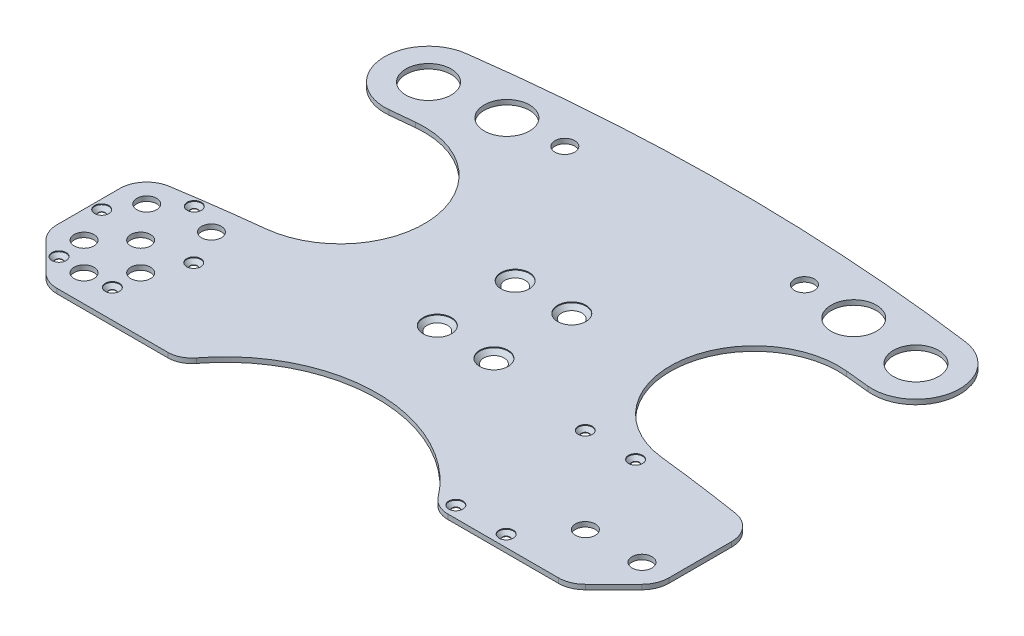
from build123d import *

# Parameters (mm, degrees)
SKETCH1_R                                      = 2.5
BOSS_EXTRUDE1_DEPTH                            = 1.7
CUT_EXTRUDE1_REACH                             = 155.062
SKETCH2_R                                      = 3.5
SKETCH2_R_2                                    = 8
CUT_EXTRUDE2_REACH                             = 155.062
SKETCH3_R                                      = 1.3
FILLET1_R                                      = 8.5
CUT_EXTRUDE3_REACH                             = 136.744
SKETCH8_R                                      = 1.25
CSK_FOR_M5_FLAT_HEAD_MACHINE_SCREW1_AT_2_COUNT = 2
CSK_FOR_M5_FLAT_HEAD_MACHINE_SCREW1_AT_2_PITCH = 20
CSK_FOR_M5_FLAT_HEAD_MACHINE_SCREW1_AT_3_COUNT = 2
CSK_FOR_M5_FLAT_HEAD_MACHINE_SCREW1_AT_3_PITCH = 34.003676272
CSK_FOR_M5_FLAT_HEAD_MACHINE_SCREW1_AT_4_COUNT = 2
CSK_FOR_M5_FLAT_HEAD_MACHINE_SCREW1_AT_4_PITCH = 27.5
CSK_FOR_M2_5_FLAT_HEAD_MACHINE_SCREW1_AT_COUNT = 2
CSK_FOR_M2_5_FLAT_HEAD_MACHINE_SCREW1_AT_PITCH = 17.78
CSK_FOR_M2_5_FLAT_HEAD_MACHINE_SCREW_2_COUNT   = 2
CSK_FOR_M2_5_FLAT_HEAD_MACHINE_SCREW_2_PITCH   = 49.055548106
CSK_FOR_M2_5_FLAT_HEAD_MACHINE_SCREW_3_COUNT   = 2
CSK_FOR_M2_5_FLAT_HEAD_MACHINE_SCREW_3_PITCH   = 45.72
CSK_FOR_M2_5_FLAT_HEAD_MACHINE_SCREW_4_COUNT   = 2
CSK_FOR_M2_5_FLAT_HEAD_MACHINE_SCREW_4_PITCH   = 137.589286773
CSK_FOR_M2_5_FLAT_HEAD_MACHINE_SCREW_5_COUNT   = 2
CSK_FOR_M2_5_FLAT_HEAD_MACHINE_SCREW_5_PITCH   = 121.758213801
CSK_FOR_M2_5_FLAT_HEAD_MACHINE_SCREW_6_COUNT   = 2
CSK_FOR_M2_5_FLAT_HEAD_MACHINE_SCREW_6_PITCH   = 153.980488141
CSK_FOR_M2_5_FLAT_HEAD_MACHINE_SCREW_7_COUNT   = 2
CSK_FOR_M2_5_FLAT_HEAD_MACHINE_SCREW_7_PITCH   = 151.428910743
CSK_FOR_M2_5_FLAT_HEAD_MACHINE_SCREW_8_COUNT   = 2
CSK_FOR_M2_5_FLAT_HEAD_MACHINE_SCREW_8_PITCH   = 133.343575359


with BuildPart() as part:
    # Sketch1 → Boss-Extrude1 (new body)
    with BuildSketch(Plane(origin=(0, 0, 0), x_dir=(1, 0, 0), z_dir=(0, 1, 0))):
        with BuildLine():
            Line((-73.314391493, -95), (73.314391493, -95))
            ThreePointArc((73.314391493, -95), (120, 0), (73.314391493, 95))
            Line((73.314391493, 95), (-73.314391493, 95))
            ThreePointArc((-73.314391493, 95), (-120, 0), (-73.314391493, -95))
        make_face()
        with Locations((-10, 13.75)):
            Circle(SKETCH1_R, mode=Mode.SUBTRACT)
        with Locations((-10, -13.75)):
            Circle(SKETCH1_R, mode=Mode.SUBTRACT)
        with Locations((10, -13.75)):
            Circle(SKETCH1_R, mode=Mode.SUBTRACT)
        with Locations((10, 13.75)):
            Circle(SKETCH1_R, mode=Mode.SUBTRACT)
    extrude(amount=BOSS_EXTRUDE1_DEPTH)

    # Sketch2 → Cut-Extrude1 (cut, up to next)
    with BuildSketch(Plane(origin=(0, 1.7, 0), x_dir=(1, 0, 0), z_dir=(0, 1, 0)), mode=Mode.PRIVATE) as cut_extrude1_sk1:
        with Locations((-88.540600769, -40)):
            Circle(SKETCH2_R)
    cut_extrude1_tool1 = extrude(cut_extrude1_sk1.sketch, amount=-CUT_EXTRUDE1_REACH, mode=Mode.PRIVATE) & part.part
    # Sketch2 → Cut-Extrude1 (cut, up to next)
    with BuildSketch(Plane(origin=(0, 1.7, 0), x_dir=(1, 0, 0), z_dir=(0, 1, 0)), mode=Mode.PRIVATE) as cut_extrude1_sk2:
        with Locations((-78.540600769, -50)):
            Circle(SKETCH2_R)
    cut_extrude1_tool2 = extrude(cut_extrude1_sk2.sketch, amount=-CUT_EXTRUDE1_REACH, mode=Mode.PRIVATE) & part.part
    # Sketch2 → Cut-Extrude1 (cut, up to next)
    with BuildSketch(Plane(origin=(0, 1.7, 0), x_dir=(1, 0, 0), z_dir=(0, 1, 0)), mode=Mode.PRIVATE) as cut_extrude1_sk3:
        with Locations((-88.540600769, -60)):
            Circle(SKETCH2_R)
    cut_extrude1_tool3 = extrude(cut_extrude1_sk3.sketch, amount=-CUT_EXTRUDE1_REACH, mode=Mode.PRIVATE) & part.part
    # Sketch2 → Cut-Extrude1 (cut, up to next)
    with BuildSketch(Plane(origin=(0, 1.7, 0), x_dir=(1, 0, 0), z_dir=(0, 1, 0)), mode=Mode.PRIVATE) as cut_extrude1_sk4:
        with Locations((-98.540600769, -50)):
            Circle(SKETCH2_R)
    cut_extrude1_tool4 = extrude(cut_extrude1_sk4.sketch, amount=-CUT_EXTRUDE1_REACH, mode=Mode.PRIVATE) & part.part
    # Sketch2 → Cut-Extrude1 (cut, up to next)
    with BuildSketch(Plane(origin=(0, 1.7, 0), x_dir=(1, 0, 0), z_dir=(0, 1, 0)), mode=Mode.PRIVATE) as cut_extrude1_sk5:
        with Locations((78.540600769, -50)):
            Circle(SKETCH2_R)
    cut_extrude1_tool5 = extrude(cut_extrude1_sk5.sketch, amount=-CUT_EXTRUDE1_REACH, mode=Mode.PRIVATE) & part.part
    # Sketch2 → Cut-Extrude1 (cut, up to next)
    with BuildSketch(Plane(origin=(0, 1.7, 0), x_dir=(1, 0, 0), z_dir=(0, 1, 0)), mode=Mode.PRIVATE) as cut_extrude1_sk6:
        with Locations((98.540600769, -50)):
            Circle(SKETCH2_R)
    cut_extrude1_tool6 = extrude(cut_extrude1_sk6.sketch, amount=-CUT_EXTRUDE1_REACH, mode=Mode.PRIVATE) & part.part
    # Sketch2 → Cut-Extrude1 (cut, up to next)
    with BuildSketch(Plane(origin=(0, 1.7, 0), x_dir=(1, 0, 0), z_dir=(0, 1, 0)), mode=Mode.PRIVATE) as cut_extrude1_sk7:
        with Locations((-98.540600769, -27.862546721)):
            Circle(SKETCH2_R)
    cut_extrude1_tool7 = extrude(cut_extrude1_sk7.sketch, amount=-CUT_EXTRUDE1_REACH, mode=Mode.PRIVATE) & part.part
    # Sketch2 → Cut-Extrude1 (cut, up to next)
    with BuildSketch(Plane(origin=(0, 1.7, 0), x_dir=(1, 0, 0), z_dir=(0, 1, 0)), mode=Mode.PRIVATE) as cut_extrude1_sk8:
        with Locations((-78.540600769, -25)):
            Circle(SKETCH2_R)
    cut_extrude1_tool8 = extrude(cut_extrude1_sk8.sketch, amount=-CUT_EXTRUDE1_REACH, mode=Mode.PRIVATE) & part.part
    # Sketch2 → Cut-Extrude1 (cut, up to next)
    with BuildSketch(Plane(origin=(0, 1.7, 0), x_dir=(1, 0, 0), z_dir=(0, 1, 0)), mode=Mode.PRIVATE) as cut_extrude1_sk9:
        with Locations((-86.094520408, 59.228232759)):
            Circle(SKETCH2_R_2)
    cut_extrude1_tool9 = extrude(cut_extrude1_sk9.sketch, amount=-CUT_EXTRUDE1_REACH, mode=Mode.PRIVATE) & part.part
    # Sketch2 → Cut-Extrude1 (cut, up to next)
    with BuildSketch(Plane(origin=(0, 1.7, 0), x_dir=(1, 0, 0), z_dir=(0, 1, 0)), mode=Mode.PRIVATE) as cut_extrude1_sk10:
        with Locations((-61.259580586, 62.084312054)):
            Circle(SKETCH2_R_2)
    cut_extrude1_tool10 = extrude(cut_extrude1_sk10.sketch, amount=-CUT_EXTRUDE1_REACH, mode=Mode.PRIVATE) & part.part
    # Sketch2 → Cut-Extrude1 (cut, up to next)
    with BuildSketch(Plane(origin=(0, 1.7, 0), x_dir=(1, 0, 0), z_dir=(0, 1, 0)), mode=Mode.PRIVATE) as cut_extrude1_sk11:
        with Locations((61.259580586, 62.084312054)):
            Circle(SKETCH2_R_2)
    cut_extrude1_tool11 = extrude(cut_extrude1_sk11.sketch, amount=-CUT_EXTRUDE1_REACH, mode=Mode.PRIVATE) & part.part
    # Sketch2 → Cut-Extrude1 (cut, up to next)
    with BuildSketch(Plane(origin=(0, 1.7, 0), x_dir=(1, 0, 0), z_dir=(0, 1, 0)), mode=Mode.PRIVATE) as cut_extrude1_sk12:
        with Locations((86.094520408, 59.228232759)):
            Circle(SKETCH2_R_2)
    cut_extrude1_tool12 = extrude(cut_extrude1_sk12.sketch, amount=-CUT_EXTRUDE1_REACH, mode=Mode.PRIVATE) & part.part
    # Sketch2 → Cut-Extrude1 (cut, up to next)
    with BuildSketch(Plane(origin=(0, 1.7, 0), x_dir=(1, 0, 0), z_dir=(0, 1, 0)), mode=Mode.PRIVATE) as cut_extrude1_sk13:
        with Locations((-42.320942156, 63.610082158)):
            Circle(SKETCH2_R)
    cut_extrude1_tool13 = extrude(cut_extrude1_sk13.sketch, amount=-CUT_EXTRUDE1_REACH, mode=Mode.PRIVATE) & part.part
    # Sketch2 → Cut-Extrude1 (cut, up to next)
    with BuildSketch(Plane(origin=(0, 1.7, 0), x_dir=(1, 0, 0), z_dir=(0, 1, 0)), mode=Mode.PRIVATE) as cut_extrude1_sk14:
        with Locations((42.320942156, 63.610082158)):
            Circle(SKETCH2_R)
    cut_extrude1_tool14 = extrude(cut_extrude1_sk14.sketch, amount=-CUT_EXTRUDE1_REACH, mode=Mode.PRIVATE) & part.part
    add(cut_extrude1_tool1.solids().sort_by_distance((-88.540601, 1.7, 40))[0], mode=Mode.SUBTRACT)
    add(cut_extrude1_tool2.solids().sort_by_distance((-78.540601, 1.7, 50))[0], mode=Mode.SUBTRACT)
    add(cut_extrude1_tool3.solids().sort_by_distance((-88.540601, 1.7, 60))[0], mode=Mode.SUBTRACT)
    add(cut_extrude1_tool4.solids().sort_by_distance((-98.540601, 1.7, 50))[0], mode=Mode.SUBTRACT)
    add(cut_extrude1_tool5.solids().sort_by_distance((78.540601, 1.7, 50))[0], mode=Mode.SUBTRACT)
    add(cut_extrude1_tool6.solids().sort_by_distance((98.540601, 1.7, 50))[0], mode=Mode.SUBTRACT)
    add(cut_extrude1_tool7.solids().sort_by_distance((-98.540601, 1.7, 27.862547))[0], mode=Mode.SUBTRACT)
    add(cut_extrude1_tool8.solids().sort_by_distance((-78.540601, 1.7, 25))[0], mode=Mode.SUBTRACT)
    add(cut_extrude1_tool9.solids().sort_by_distance((-86.09452, 1.7, -59.228233))[0], mode=Mode.SUBTRACT)
    add(cut_extrude1_tool10.solids().sort_by_distance((-61.259581, 1.7, -62.084312))[0], mode=Mode.SUBTRACT)
    add(cut_extrude1_tool11.solids().sort_by_distance((61.259581, 1.7, -62.084312))[0], mode=Mode.SUBTRACT)
    add(cut_extrude1_tool12.solids().sort_by_distance((86.09452, 1.7, -59.228233))[0], mode=Mode.SUBTRACT)
    add(cut_extrude1_tool13.solids().sort_by_distance((-42.320942, 1.7, -63.610082))[0], mode=Mode.SUBTRACT)
    add(cut_extrude1_tool14.solids().sort_by_distance((42.320942, 1.7, -63.610082))[0], mode=Mode.SUBTRACT)

    # Sketch3 → Cut-Extrude2 (cut, up to next)
    with BuildSketch(Plane(origin=(0, 1.7, 0), x_dir=(1, 0, 0), z_dir=(0, 1, 0)), mode=Mode.PRIVATE) as cut_extrude2_sk1:
        with BuildLine():
            Line((-76.105927639, 44.650651409), (-84.550645906, 43.805313077))
            ThreePointArc((-84.550645906, 43.805313077), (-99.436668511, 51.3391844), (-98.864520746, 68.013282068))
            ThreePointArc((-98.864520746, 68.013282068), (-119.734623685, 7.97620781), (-107.012417284, -54.298642221))
            ThreePointArc((-107.012417284, -54.298642221), (-107.779979993, -52.209948315), (-108.040600769, -50))
            Line((-108.040600769, -50), (-108.040600769, -27.862546721))
            ThreePointArc((-108.040600769, -27.862546721), (-105.768300058, -21.697292226), (-100.038419088, -18.48136661))
            ThreePointArc((-100.038419088, -18.48136661), (-84.982869073, -16.262381047), (-69.878431936, -14.405108326))
            ThreePointArc((-69.878431936, -14.405108326), (-43.620166551, 18.220083083), (-76.105927639, 44.650651409))
        make_face()
    cut_extrude2_tool1 = extrude(cut_extrude2_sk1.sketch, amount=-CUT_EXTRUDE2_REACH, mode=Mode.PRIVATE) & part.part
    # Sketch3 → Cut-Extrude2 (cut, up to next)
    with BuildSketch(Plane(origin=(0, 1.7, 0), x_dir=(1, 0, 0), z_dir=(0, 1, 0)), mode=Mode.PRIVATE) as cut_extrude2_sk2:
        with BuildLine():
            ThreePointArc((-98.864520746, 68.013282068), (-94.209947077, 72.433907674), (-88.163438842, 74.589534022))
            ThreePointArc((-88.163438842, 74.589534022), (2.1e-08, 80.5), (88.163438884, 74.589534017))
            ThreePointArc((88.163438884, 74.589534017), (94.209947407, 72.433907471), (98.864521161, 68.013281465))
            ThreePointArc((98.864521161, 68.013281465), (87.140491363, 82.50172583), (73.314391493, 95))
            Line((73.314391493, 95), (-73.314391493, 95))
            ThreePointArc((-73.314391493, 95), (-87.140491112, 82.501726096), (-98.864520746, 68.013282068))
        make_face()
    cut_extrude2_tool2 = extrude(cut_extrude2_sk2.sketch, amount=-CUT_EXTRUDE2_REACH, mode=Mode.PRIVATE) & part.part
    # Sketch3 → Cut-Extrude2 (cut, up to next)
    with BuildSketch(Plane(origin=(0, 1.7, 0), x_dir=(1, 0, 0), z_dir=(0, 1, 0)), mode=Mode.PRIVATE) as cut_extrude2_sk3:
        with BuildLine():
            ThreePointArc((-105.258115191, -56.717514421), (-106.230963521, -55.577483371), (-107.012417284, -54.298642221))
            ThreePointArc((-107.012417284, -54.298642221), (-92.431540192, -76.527187181), (-73.314391493, -95))
            Line((-73.314391493, -95), (73.314391493, -95))
            ThreePointArc((73.314391493, -95), (92.431540082, -76.527187314), (107.012417128, -54.298642528))
            ThreePointArc((107.012417128, -54.298642528), (106.23096342, -55.57748351), (105.258115191, -56.717514421))
            Line((105.258115191, -56.717514421), (95.258115191, -66.717514421))
            ThreePointArc((95.258115191, -66.717514421), (92.176093377, -68.776855559), (88.540600769, -69.5))
            Line((88.540600769, -69.5), (45.040600769, -69.5))
            ThreePointArc((45.040600769, -69.5), (0, -45), (-45.040600769, -69.5))
            Line((-45.040600769, -69.5), (-88.540600769, -69.5))
            ThreePointArc((-88.540600769, -69.5), (-92.176093377, -68.776855559), (-95.258115191, -66.717514421))
            Line((-95.258115191, -66.717514421), (-105.258115191, -56.717514421))
        make_face()
    cut_extrude2_tool3 = extrude(cut_extrude2_sk3.sketch, amount=-CUT_EXTRUDE2_REACH, mode=Mode.PRIVATE) & part.part
    # Sketch3 → Cut-Extrude2 (cut, up to next)
    with BuildSketch(Plane(origin=(0, 1.7, 0), x_dir=(1, 0, 0), z_dir=(0, 1, 0)), mode=Mode.PRIVATE) as cut_extrude2_sk4:
        with BuildLine():
            ThreePointArc((69.878433596, -14.40510851), (84.982869339, -16.262381083), (100.038417968, -18.481366431))
            ThreePointArc((100.038417968, -18.481366431), (105.768299691, -21.697291795), (108.040600769, -27.862546721))
            Line((108.040600769, -27.862546721), (108.040600769, -50))
            ThreePointArc((108.040600769, -50), (107.779979953, -52.209948483), (107.012417128, -54.298642528))
            ThreePointArc((107.012417128, -54.298642528), (119.734623721, 7.976207273), (98.864521161, 68.013281465))
            ThreePointArc((98.864521161, 68.013281465), (99.436668324, 51.339184085), (84.550645906, 43.805313077))
            Line((84.550645906, 43.805313077), (76.105927251, 44.650651448))
            ThreePointArc((76.105927251, 44.650651448), (43.620166443, 18.220082059), (69.878433596, -14.40510851))
        make_face()
    cut_extrude2_tool4 = extrude(cut_extrude2_sk4.sketch, amount=-CUT_EXTRUDE2_REACH, mode=Mode.PRIVATE) & part.part
    # Sketch3 → Cut-Extrude2 (cut, up to next)
    with BuildSketch(Plane(origin=(0, 1.7, 0), x_dir=(1, 0, 0), z_dir=(0, 1, 0)), mode=Mode.PRIVATE) as cut_extrude2_sk5:
        with Locations((48.150600769, -19.64)):
            Circle(SKETCH3_R)
    cut_extrude2_tool5 = extrude(cut_extrude2_sk5.sketch, amount=-CUT_EXTRUDE2_REACH, mode=Mode.PRIVATE) & part.part
    # Sketch3 → Cut-Extrude2 (cut, up to next)
    with BuildSketch(Plane(origin=(0, 1.7, 0), x_dir=(1, 0, 0), z_dir=(0, 1, 0)), mode=Mode.PRIVATE) as cut_extrude2_sk6:
        with Locations((65.930600769, -19.64)):
            Circle(SKETCH3_R)
    cut_extrude2_tool6 = extrude(cut_extrude2_sk6.sketch, amount=-CUT_EXTRUDE2_REACH, mode=Mode.PRIVATE) & part.part
    # Sketch3 → Cut-Extrude2 (cut, up to next)
    with BuildSketch(Plane(origin=(0, 1.7, 0), x_dir=(1, 0, 0), z_dir=(0, 1, 0)), mode=Mode.PRIVATE) as cut_extrude2_sk7:
        with Locations((65.930600769, -65.36)):
            Circle(SKETCH3_R)
    cut_extrude2_tool7 = extrude(cut_extrude2_sk7.sketch, amount=-CUT_EXTRUDE2_REACH, mode=Mode.PRIVATE) & part.part
    # Sketch3 → Cut-Extrude2 (cut, up to next)
    with BuildSketch(Plane(origin=(0, 1.7, 0), x_dir=(1, 0, 0), z_dir=(0, 1, 0)), mode=Mode.PRIVATE) as cut_extrude2_sk8:
        with Locations((48.150600769, -65.36)):
            Circle(SKETCH3_R)
    cut_extrude2_tool8 = extrude(cut_extrude2_sk8.sketch, amount=-CUT_EXTRUDE2_REACH, mode=Mode.PRIVATE) & part.part
    add(cut_extrude2_tool1.solids().sort_by_distance((-86.043963, 1.7, -12.513289))[0], mode=Mode.SUBTRACT)
    add(cut_extrude2_tool2.solids().sort_by_distance((0, 1.7, -86.177495))[0], mode=Mode.SUBTRACT)
    add(cut_extrude2_tool3.solids().sort_by_distance((0, 1.7, 75.736765))[0], mode=Mode.SUBTRACT)
    add(cut_extrude2_tool4.solids().sort_by_distance((86.043963, 1.7, -12.513289))[0], mode=Mode.SUBTRACT)
    add(cut_extrude2_tool5.solids().sort_by_distance((48.150601, 1.7, 19.64))[0], mode=Mode.SUBTRACT)
    add(cut_extrude2_tool6.solids().sort_by_distance((65.930601, 1.7, 19.64))[0], mode=Mode.SUBTRACT)
    add(cut_extrude2_tool7.solids().sort_by_distance((65.930601, 1.7, 65.36))[0], mode=Mode.SUBTRACT)
    add(cut_extrude2_tool8.solids().sort_by_distance((48.150601, 1.7, 65.36))[0], mode=Mode.SUBTRACT)

    # Fillet1
    fillet1_edges = [part.edges().sort_by_distance(p)[0] for p in [
        (45.040600769, 0.85, 69.5),
        (-45.040600769, 0.85, 69.5),
    ]]
    fillet(fillet1_edges, radius=FILLET1_R)

    # Sketch8 → Cut-Extrude3 (cut, up to next)
    with BuildSketch(Plane(origin=(0, 1.7, 0), x_dir=(1, 0, 0), z_dir=(0, 1, 0)), mode=Mode.PRIVATE) as cut_extrude3_sk1:
        with Locations((-89.437690082, -20.163502734)):
            Circle(SKETCH8_R)
    cut_extrude3_tool1 = extrude(cut_extrude3_sk1.sketch, amount=-CUT_EXTRUDE3_REACH, mode=Mode.PRIVATE) & part.part
    # Sketch8 → Cut-Extrude3 (cut, up to next)
    with BuildSketch(Plane(origin=(0, 1.7, 0), x_dir=(1, 0, 0), z_dir=(0, 1, 0)), mode=Mode.PRIVATE) as cut_extrude3_sk2:
        with Locations((-104.790600769, -37.5)):
            Circle(SKETCH8_R)
    cut_extrude3_tool2 = extrude(cut_extrude3_sk2.sketch, amount=-CUT_EXTRUDE3_REACH, mode=Mode.PRIVATE) & part.part
    # Sketch8 → Cut-Extrude3 (cut, up to next)
    with BuildSketch(Plane(origin=(0, 1.7, 0), x_dir=(1, 0, 0), z_dir=(0, 1, 0)), mode=Mode.PRIVATE) as cut_extrude3_sk3:
        with Locations((-72.290600769, -37.5)):
            Circle(SKETCH8_R)
    cut_extrude3_tool3 = extrude(cut_extrude3_sk3.sketch, amount=-CUT_EXTRUDE3_REACH, mode=Mode.PRIVATE) & part.part
    # Sketch8 → Cut-Extrude3 (cut, up to next)
    with BuildSketch(Plane(origin=(0, 1.7, 0), x_dir=(1, 0, 0), z_dir=(0, 1, 0)), mode=Mode.PRIVATE) as cut_extrude3_sk4:
        with Locations((-97.960018152, -59.419417382)):
            Circle(SKETCH8_R)
    cut_extrude3_tool4 = extrude(cut_extrude3_sk4.sketch, amount=-CUT_EXTRUDE3_REACH, mode=Mode.PRIVATE) & part.part
    # Sketch8 → Cut-Extrude3 (cut, up to next)
    with BuildSketch(Plane(origin=(0, 1.7, 0), x_dir=(1, 0, 0), z_dir=(0, 1, 0)), mode=Mode.PRIVATE) as cut_extrude3_sk5:
        with Locations((-79.121183387, -59.419417382)):
            Circle(SKETCH8_R)
    cut_extrude3_tool5 = extrude(cut_extrude3_sk5.sketch, amount=-CUT_EXTRUDE3_REACH, mode=Mode.PRIVATE) & part.part
    add(cut_extrude3_tool1.solids().sort_by_distance((-89.43769, 1.7, 20.163503))[0], mode=Mode.SUBTRACT)
    add(cut_extrude3_tool2.solids().sort_by_distance((-104.790601, 1.7, 37.5))[0], mode=Mode.SUBTRACT)
    add(cut_extrude3_tool3.solids().sort_by_distance((-72.290601, 1.7, 37.5))[0], mode=Mode.SUBTRACT)
    add(cut_extrude3_tool4.solids().sort_by_distance((-97.960018, 1.7, 59.419417))[0], mode=Mode.SUBTRACT)
    add(cut_extrude3_tool5.solids().sort_by_distance((-79.121183, 1.7, 59.419417))[0], mode=Mode.SUBTRACT)

    # Sketch5 → CSK for M5 Flat Head Machine Screw1 (revolve, cut)
    with BuildSketch(Plane(origin=(-10, 1.7, -13.75), x_dir=(0, 0, 1), z_dir=(1, 0, 0))):
        Polygon((0, 0), (0, 6.502151548), (2.5, 5), (2.5, 2.8), (5, 0.3), (5, 0), align=None)
    csk_for_m5_flat_head_machine_screw1 = revolve(axis=Axis((-10, 8.05, -13.75), (0, -1, 0)), mode=Mode.SUBTRACT)

    # CSK for M5 Flat Head Machine Screw1 at 2: CSK for M5 Flat Head Machine Screw1 ×2
    with Locations(*[(i * CSK_FOR_M5_FLAT_HEAD_MACHINE_SCREW1_AT_2_PITCH, 0, 0) for i in range(1, CSK_FOR_M5_FLAT_HEAD_MACHINE_SCREW1_AT_2_COUNT)]):
        add(csk_for_m5_flat_head_machine_screw1, mode=Mode.SUBTRACT)

    # CSK for M5 Flat Head Machine Screw1 at 3: CSK for M5 Flat Head Machine Screw1 ×2
    with Locations(*[Vector(0.5881716976750462, 0, 0.8087360843031886) * (i * CSK_FOR_M5_FLAT_HEAD_MACHINE_SCREW1_AT_3_PITCH) for i in range(1, CSK_FOR_M5_FLAT_HEAD_MACHINE_SCREW1_AT_3_COUNT)]):
        add(csk_for_m5_flat_head_machine_screw1, mode=Mode.SUBTRACT)

    # CSK for M5 Flat Head Machine Screw1 at 4: CSK for M5 Flat Head Machine Screw1 ×2
    with Locations(*[(0, 0, i * CSK_FOR_M5_FLAT_HEAD_MACHINE_SCREW1_AT_4_PITCH) for i in range(1, CSK_FOR_M5_FLAT_HEAD_MACHINE_SCREW1_AT_4_COUNT)]):
        add(csk_for_m5_flat_head_machine_screw1, mode=Mode.SUBTRACT)

    # Sketch7 → CSK for M2.5 Flat Head Machine Screw1 (revolve, cut)
    with BuildSketch(Plane(origin=(48.150600769, 1.7, 19.64), x_dir=(0, 0, 1), z_dir=(1, 0, 0))):
        Polygon((0, 0), (0, 5.751075774), (1.25, 5), (1.25, 1.55), (2.5, 0.3), (2.5, 0), align=None)
    csk_for_m2_5_flat_head_machine_screw1 = revolve(axis=Axis((48.150600769, 8.05, 19.64), (0, -1, 0)), mode=Mode.SUBTRACT)

    # CSK for M2.5 Flat Head Machine Screw1 at: CSK for M2.5 Flat Head Machine Screw1 ×2
    with Locations(*[(i * CSK_FOR_M2_5_FLAT_HEAD_MACHINE_SCREW1_AT_PITCH, 0, 0) for i in range(1, CSK_FOR_M2_5_FLAT_HEAD_MACHINE_SCREW1_AT_COUNT)]):
        add(csk_for_m2_5_flat_head_machine_screw1, mode=Mode.SUBTRACT)

    # CSK for M2.5 Flat Head Machine Screw 2: CSK for M2.5 Flat Head Machine Screw1 ×2
    with Locations(*[Vector(0.3624462611549487, 0, 0.9320046715412958) * (i * CSK_FOR_M2_5_FLAT_HEAD_MACHINE_SCREW_2_PITCH) for i in range(1, CSK_FOR_M2_5_FLAT_HEAD_MACHINE_SCREW_2_COUNT)]):
        add(csk_for_m2_5_flat_head_machine_screw1, mode=Mode.SUBTRACT)

    # CSK for M2.5 Flat Head Machine Screw 3: CSK for M2.5 Flat Head Machine Screw1 ×2
    with Locations(*[(0, 0, i * CSK_FOR_M2_5_FLAT_HEAD_MACHINE_SCREW_3_PITCH) for i in range(1, CSK_FOR_M2_5_FLAT_HEAD_MACHINE_SCREW_3_COUNT)]):
        add(csk_for_m2_5_flat_head_machine_screw1, mode=Mode.SUBTRACT)

    # CSK for M2.5 Flat Head Machine Screw 4: CSK for M2.5 Flat Head Machine Screw1 ×2
    with Locations(*[Vector(-0.9999927616388844, 0, 0.00380482191926873) * (i * CSK_FOR_M2_5_FLAT_HEAD_MACHINE_SCREW_4_PITCH) for i in range(1, CSK_FOR_M2_5_FLAT_HEAD_MACHINE_SCREW_4_COUNT)]):
        add(csk_for_m2_5_flat_head_machine_screw1, mode=Mode.SUBTRACT)

    # CSK for M2.5 Flat Head Machine Screw 5: CSK for M2.5 Flat Head Machine Screw1 ×2
    with Locations(*[Vector(-0.9891833805581551, 0, 0.14668414920345021) * (i * CSK_FOR_M2_5_FLAT_HEAD_MACHINE_SCREW_5_PITCH) for i in range(1, CSK_FOR_M2_5_FLAT_HEAD_MACHINE_SCREW_5_COUNT)]):
        add(csk_for_m2_5_flat_head_machine_screw1, mode=Mode.SUBTRACT)

    # CSK for M2.5 Flat Head Machine Screw 6: CSK for M2.5 Flat Head Machine Screw1 ×2
    with Locations(*[Vector(-0.993250530539823, 0, 0.11598872178949203) * (i * CSK_FOR_M2_5_FLAT_HEAD_MACHINE_SCREW_6_PITCH) for i in range(1, CSK_FOR_M2_5_FLAT_HEAD_MACHINE_SCREW_6_COUNT)]):
        add(csk_for_m2_5_flat_head_machine_screw1, mode=Mode.SUBTRACT)

    # CSK for M2.5 Flat Head Machine Screw 7: CSK for M2.5 Flat Head Machine Screw1 ×2
    with Locations(*[Vector(-0.964879283647163, 0, 0.262693677100416) * (i * CSK_FOR_M2_5_FLAT_HEAD_MACHINE_SCREW_7_PITCH) for i in range(1, CSK_FOR_M2_5_FLAT_HEAD_MACHINE_SCREW_7_COUNT)]):
        add(csk_for_m2_5_flat_head_machine_screw1, mode=Mode.SUBTRACT)

    # CSK for M2.5 Flat Head Machine Screw 8: CSK for M2.5 Flat Head Machine Screw1 ×2
    with Locations(*[Vector(-0.9544650637522963, 0, 0.2983227146503008) * (i * CSK_FOR_M2_5_FLAT_HEAD_MACHINE_SCREW_8_PITCH) for i in range(1, CSK_FOR_M2_5_FLAT_HEAD_MACHINE_SCREW_8_COUNT)]):
        add(csk_for_m2_5_flat_head_machine_screw1, mode=Mode.SUBTRACT)


solid = part.part
